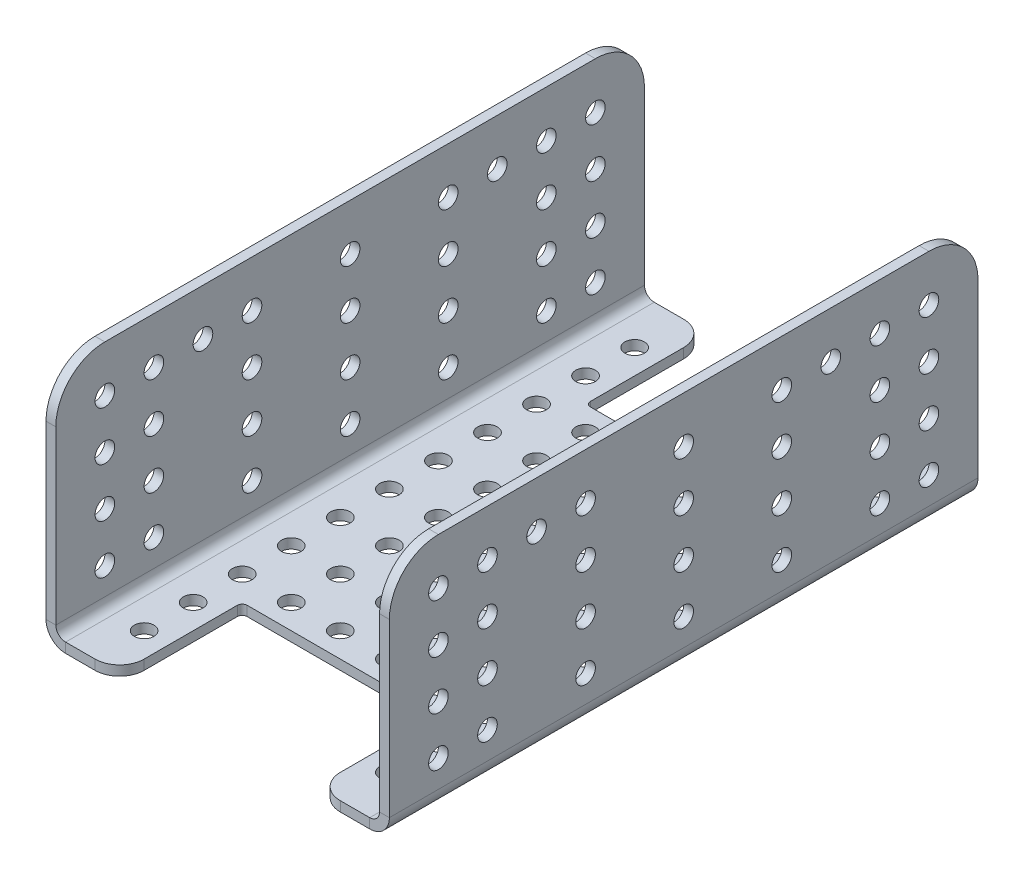
from build123d import *

# Parameters (mm, degrees)
SKETCH1_W                      = 66
SKETCH1_H                      = 120
BOSS_EXTRUDE1_DEPTH            = 2
SKETCH2_R                      = 2
CUT_EXTRUDE1_DEPTH             = 137.967149346
EDGE_FLANGE1_STRIP_W           = 12
EDGE_FLANGE1_STRIP_H           = 2
EDGE_FLANGE1_STRIP_CUT_DEPTH   = 120
EDGE_FLANGE1_STRIP_2_W         = 12
EDGE_FLANGE1_STRIP_2_H         = 2
EDGE_FLANGE1_STRIP_CUT_2_DEPTH = 120
EDGE_FLANGE1_DEPTH             = 120
EDGE_FLANGE1_BEND_DEPTH        = 120
SKETCH24_W                     = 40
SKETCH24_H                     = 25
CUT_EXTRUDE6_DEPTH             = 146.715476186
FILLET1_R                      = 10
FILLET2_R                      = 5
FILLET3_R                      = 1
SKETCH25_R                     = 2
CUT_EXTRUDE8_DEPTH             = 148.312592809


# Sheet-metal steps are written as plain solids
with BuildPart() as part:
    # Sketch1 → Boss-Extrude1 (new body)
    with BuildSketch(Plane(origin=(0, 0, 0), x_dir=(1, 0, 0), z_dir=(0, 1, 0))):
        with Locations((33, 60)):
            Rectangle(SKETCH1_W, SKETCH1_H)
    extrude(amount=BOSS_EXTRUDE1_DEPTH)

    # Sketch2 → Cut-Extrude1 (cut, through all)
    with BuildSketch(Plane(origin=(0, 2, 0), x_dir=(1, 0, 0), z_dir=(0, 1, 0))):
        with Locations(Location((8, 110, 0), (0, 0, 270))):
            Circle(SKETCH2_R)
        with Locations(Location((18, 110, 0), (0, 0, 270))):
            Circle(SKETCH2_R)
        with Locations(Location((28, 110, 0), (0, 0, 270))):
            Circle(SKETCH2_R)
        with Locations(Location((38, 110, 0), (0, 0, 270))):
            Circle(SKETCH2_R)
        with Locations(Location((48, 110, 0), (0, 0, 270))):
            Circle(SKETCH2_R)
        with Locations(Location((58, 110, 0), (0, 0, 270))):
            Circle(SKETCH2_R)
        with Locations(Location((18, 100, 0), (0, 0, 270))):
            Circle(SKETCH2_R)
        with Locations(Location((28, 100, 0), (0, 0, 270))):
            Circle(SKETCH2_R)
        with Locations(Location((38, 100, 0), (0, 0, 270))):
            Circle(SKETCH2_R)
        with Locations(Location((48, 100, 0), (0, 0, 270))):
            Circle(SKETCH2_R)
        with Locations(Location((58, 100, 0), (0, 0, 270))):
            Circle(SKETCH2_R)
        with Locations(Location((18, 90, 0), (0, 0, 270))):
            Circle(SKETCH2_R)
        with Locations(Location((28, 90, 0), (0, 0, 270))):
            Circle(SKETCH2_R)
        with Locations(Location((38, 90, 0), (0, 0, 270))):
            Circle(SKETCH2_R)
        with Locations(Location((48, 90, 0), (0, 0, 270))):
            Circle(SKETCH2_R)
        with Locations(Location((58, 90, 0), (0, 0, 270))):
            Circle(SKETCH2_R)
        with Locations(Location((18, 80, 0), (0, 0, 270))):
            Circle(SKETCH2_R)
        with Locations(Location((28, 80, 0), (0, 0, 270))):
            Circle(SKETCH2_R)
        with Locations(Location((38, 80, 0), (0, 0, 270))):
            Circle(SKETCH2_R)
        with Locations(Location((48, 80, 0), (0, 0, 270))):
            Circle(SKETCH2_R)
        with Locations(Location((58, 80, 0), (0, 0, 270))):
            Circle(SKETCH2_R)
        with Locations(Location((18, 70, 0), (0, 0, 270))):
            Circle(SKETCH2_R)
        with Locations(Location((28, 70, 0), (0, 0, 270))):
            Circle(SKETCH2_R)
        with Locations(Location((38, 70, 0), (0, 0, 270))):
            Circle(SKETCH2_R)
        with Locations(Location((48, 70, 0), (0, 0, 270))):
            Circle(SKETCH2_R)
        with Locations(Location((58, 70, 0), (0, 0, 270))):
            Circle(SKETCH2_R)
        with Locations(Location((18, 60, 0), (0, 0, 270))):
            Circle(SKETCH2_R)
        with Locations(Location((28, 60, 0), (0, 0, 270))):
            Circle(SKETCH2_R)
        with Locations(Location((38, 60, 0), (0, 0, 270))):
            Circle(SKETCH2_R)
        with Locations(Location((48, 60, 0), (0, 0, 270))):
            Circle(SKETCH2_R)
        with Locations(Location((58, 60, 0), (0, 0, 270))):
            Circle(SKETCH2_R)
        with Locations(Location((18, 50, 0), (0, 0, 270))):
            Circle(SKETCH2_R)
        with Locations(Location((28, 50, 0), (0, 0, 270))):
            Circle(SKETCH2_R)
        with Locations(Location((38, 50, 0), (0, 0, 270))):
            Circle(SKETCH2_R)
        with Locations(Location((48, 50, 0), (0, 0, 270))):
            Circle(SKETCH2_R)
        with Locations(Location((58, 50, 0), (0, 0, 270))):
            Circle(SKETCH2_R)
        with Locations(Location((18, 40, 0), (0, 0, 270))):
            Circle(SKETCH2_R)
        with Locations(Location((28, 40, 0), (0, 0, 270))):
            Circle(SKETCH2_R)
        with Locations(Location((38, 40, 0), (0, 0, 270))):
            Circle(SKETCH2_R)
        with Locations(Location((48, 40, 0), (0, 0, 270))):
            Circle(SKETCH2_R)
        with Locations(Location((58, 40, 0), (0, 0, 270))):
            Circle(SKETCH2_R)
        with Locations(Location((18, 30, 0), (0, 0, 270))):
            Circle(SKETCH2_R)
        with Locations(Location((28, 30, 0), (0, 0, 270))):
            Circle(SKETCH2_R)
        with Locations(Location((38, 30, 0), (0, 0, 270))):
            Circle(SKETCH2_R)
        with Locations(Location((48, 30, 0), (0, 0, 270))):
            Circle(SKETCH2_R)
        with Locations(Location((58, 30, 0), (0, 0, 270))):
            Circle(SKETCH2_R)
        with Locations(Location((18, 20, 0), (0, 0, 270))):
            Circle(SKETCH2_R)
        with Locations(Location((28, 20, 0), (0, 0, 270))):
            Circle(SKETCH2_R)
        with Locations(Location((38, 20, 0), (0, 0, 270))):
            Circle(SKETCH2_R)
        with Locations(Location((48, 20, 0), (0, 0, 270))):
            Circle(SKETCH2_R)
        with Locations(Location((58, 20, 0), (0, 0, 270))):
            Circle(SKETCH2_R)
        with Locations(Location((18, 10, 0), (0, 0, 270))):
            Circle(SKETCH2_R)
        with Locations(Location((28, 10, 0), (0, 0, 270))):
            Circle(SKETCH2_R)
        with Locations(Location((38, 10, 0), (0, 0, 270))):
            Circle(SKETCH2_R)
        with Locations(Location((48, 10, 0), (0, 0, 270))):
            Circle(SKETCH2_R)
        with Locations(Location((58, 10, 0), (0, 0, 270))):
            Circle(SKETCH2_R)
        with Locations(Location((8, 100, 0), (0, 0, 270))):
            Circle(SKETCH2_R)
        with Locations(Location((8, 90, 0), (0, 0, 270))):
            Circle(SKETCH2_R)
        with Locations(Location((8, 80, 0), (0, 0, 270))):
            Circle(SKETCH2_R)
        with Locations(Location((8, 70, 0), (0, 0, 270))):
            Circle(SKETCH2_R)
        with Locations(Location((8, 60, 0), (0, 0, 270))):
            Circle(SKETCH2_R)
        with Locations(Location((8, 50, 0), (0, 0, 270))):
            Circle(SKETCH2_R)
        with Locations(Location((8, 40, 0), (0, 0, 270))):
            Circle(SKETCH2_R)
        with Locations(Location((8, 30, 0), (0, 0, 270))):
            Circle(SKETCH2_R)
        with Locations(Location((8, 20, 0), (0, 0, 270))):
            Circle(SKETCH2_R)
        with Locations(Location((8, 10, 0), (0, 0, 270))):
            Circle(SKETCH2_R)
    extrude(amount=-CUT_EXTRUDE1_DEPTH, mode=Mode.SUBTRACT)

    # Edge-Flange1 strip (across the edge) → Edge-Flange1 strip cut (cut)
    with BuildSketch(Plane(origin=(0, 2, -120), x_dir=(1, 0, 0), z_dir=(0, 0, 1))):
        with Locations((-4, -1)):
            Rectangle(EDGE_FLANGE1_STRIP_W, EDGE_FLANGE1_STRIP_H)
    extrude(amount=EDGE_FLANGE1_STRIP_CUT_DEPTH, mode=Mode.SUBTRACT)

    # Edge-Flange1 strip 2 (across the edge) → Edge-Flange1 strip cut 2 (cut)
    with BuildSketch(Plane(origin=(66, 2, 0), x_dir=(-1, 0, 0), z_dir=(0, 0, -1))):
        with Locations((-4, -1)):
            Rectangle(EDGE_FLANGE1_STRIP_2_W, EDGE_FLANGE1_STRIP_2_H)
    extrude(amount=EDGE_FLANGE1_STRIP_CUT_2_DEPTH, mode=Mode.SUBTRACT)

    # Edge-Flange1 section (across the edge) → Edge-Flange1 (add)
    with BuildSketch(Plane(origin=(0, 2, -120), x_dir=(1, 0, 0), z_dir=(0, 0, 1))):
        with BuildLine():
            Line((-2, 2), (-2, 47))
            Line((-2, 47), (0, 47))
            Line((0, 47), (0, 2))
            ThreePointArc((0, 2), (0.585786438, 0.585786438), (2, 0))
            Line((2, 0), (2, -2))
            ThreePointArc((2, -2), (-0.828427125, -0.828427125), (-2, 2))
        make_face()
    extrude(amount=EDGE_FLANGE1_DEPTH)

    # Edge-Flange1 section 2 (across the edge) → Edge-Flange1 bend (add)
    with BuildSketch(Plane(origin=(66, 2, 0), x_dir=(-1, 0, 0), z_dir=(0, 0, -1))):
        with BuildLine():
            Line((-2, 2), (-2, 47))
            Line((-2, 47), (0, 47))
            Line((0, 47), (0, 2))
            ThreePointArc((0, 2), (0.585786438, 0.585786438), (2, 0))
            Line((2, 0), (2, -2))
            ThreePointArc((2, -2), (-0.828427125, -0.828427125), (-2, 2))
        make_face()
    extrude(amount=EDGE_FLANGE1_BEND_DEPTH)

    # Sketch24 → Cut-Extrude6 (cut, through all)
    with BuildSketch(Plane(origin=(0, 2, 0), x_dir=(1, 0, 0), z_dir=(0, 1, 0))):
        with Locations((33, 107.5)):
            Rectangle(SKETCH24_W, SKETCH24_H)
        with Locations((33, 12.5)):
            Rectangle(SKETCH24_W, SKETCH24_H)
    extrude(amount=-CUT_EXTRUDE6_DEPTH, mode=Mode.SUBTRACT)

    # Fillet1
    fillet1_edges = [part.edges().sort_by_distance(p)[0] for p in [
        (-1, 49, -120),
        (-1, 49, 0),
        (67, 49, 0),
        (67, 49, -120),
    ]]
    fillet(fillet1_edges, radius=FILLET1_R)

    # Fillet2
    fillet2_edges = [part.edges().sort_by_distance(p)[0] for p in [
        (13, 1, -120),
        (53, 1, -120),
        (53, 1, 0),
        (13, 1, 0),
    ]]
    fillet(fillet2_edges, radius=FILLET2_R)

    # Fillet3
    fillet3_edges = [part.edges().sort_by_distance(p)[0] for p in [
        (13, 1, -95),
        (53, 1, -95),
        (13, 1, -25),
        (53, 1, -25),
    ]]
    fillet(fillet3_edges, radius=FILLET3_R)

    # Sketch25 → Cut-Extrude8 (cut, through all)
    with BuildSketch(Plane(origin=(68, 0, 0), x_dir=(0, 0, -1), z_dir=(1, 0, 0))):
        with Locations(Location((10, 39.5, 0), (0, 0, 90))):
            Circle(SKETCH25_R)
        with Locations(Location((20, 39.5, 0), (0, 0, 90))):
            Circle(SKETCH25_R)
        with Locations(Location((30, 39.5, 0), (0, 0, 90))):
            Circle(SKETCH25_R)
        with Locations(Location((40, 39.5, 0), (0, 0, 90))):
            Circle(SKETCH25_R)
        with Locations(Location((60, 39.5, 0), (0, 0, 90))):
            Circle(SKETCH25_R)
        with Locations(Location((80, 39.5, 0), (0, 0, 90))):
            Circle(SKETCH25_R)
        with Locations(Location((90, 39.5, 0), (0, 0, 90))):
            Circle(SKETCH25_R)
        with Locations(Location((100, 39.5, 0), (0, 0, 90))):
            Circle(SKETCH25_R)
        with Locations(Location((110, 39.5, 0), (0, 0, 90))):
            Circle(SKETCH25_R)
        with Locations(Location((20, 29.5, 0), (0, 0, 90))):
            Circle(SKETCH25_R)
        with Locations(Location((40, 29.5, 0), (0, 0, 90))):
            Circle(SKETCH25_R)
        with Locations(Location((60, 29.5, 0), (0, 0, 90))):
            Circle(SKETCH25_R)
        with Locations(Location((80, 29.5, 0), (0, 0, 90))):
            Circle(SKETCH25_R)
        with Locations(Location((100, 29.5, 0), (0, 0, 90))):
            Circle(SKETCH25_R)
        with Locations(Location((110, 29.5, 0), (0, 0, 90))):
            Circle(SKETCH25_R)
        with Locations(Location((20, 19.5, 0), (0, 0, 90))):
            Circle(SKETCH25_R)
        with Locations(Location((40, 19.5, 0), (0, 0, 90))):
            Circle(SKETCH25_R)
        with Locations(Location((60, 19.5, 0), (0, 0, 90))):
            Circle(SKETCH25_R)
        with Locations(Location((80, 19.5, 0), (0, 0, 90))):
            Circle(SKETCH25_R)
        with Locations(Location((100, 19.5, 0), (0, 0, 90))):
            Circle(SKETCH25_R)
        with Locations(Location((110, 19.5, 0), (0, 0, 90))):
            Circle(SKETCH25_R)
        with Locations(Location((20, 9.5, 0), (0, 0, 90))):
            Circle(SKETCH25_R)
        with Locations(Location((40, 9.5, 0), (0, 0, 90))):
            Circle(SKETCH25_R)
        with Locations(Location((60, 9.5, 0), (0, 0, 90))):
            Circle(SKETCH25_R)
        with Locations(Location((80, 9.5, 0), (0, 0, 90))):
            Circle(SKETCH25_R)
        with Locations(Location((100, 9.5, 0), (0, 0, 90))):
            Circle(SKETCH25_R)
        with Locations(Location((110, 9.5, 0), (0, 0, 90))):
            Circle(SKETCH25_R)
        with Locations(Location((10, 29.5, 0), (0, 0, 90))):
            Circle(SKETCH25_R)
        with Locations(Location((10, 19.5, 0), (0, 0, 90))):
            Circle(SKETCH25_R)
        with Locations(Location((10, 9.5, 0), (0, 0, 90))):
            Circle(SKETCH25_R)
    extrude(amount=-CUT_EXTRUDE8_DEPTH, mode=Mode.SUBTRACT)


solid = part.part
